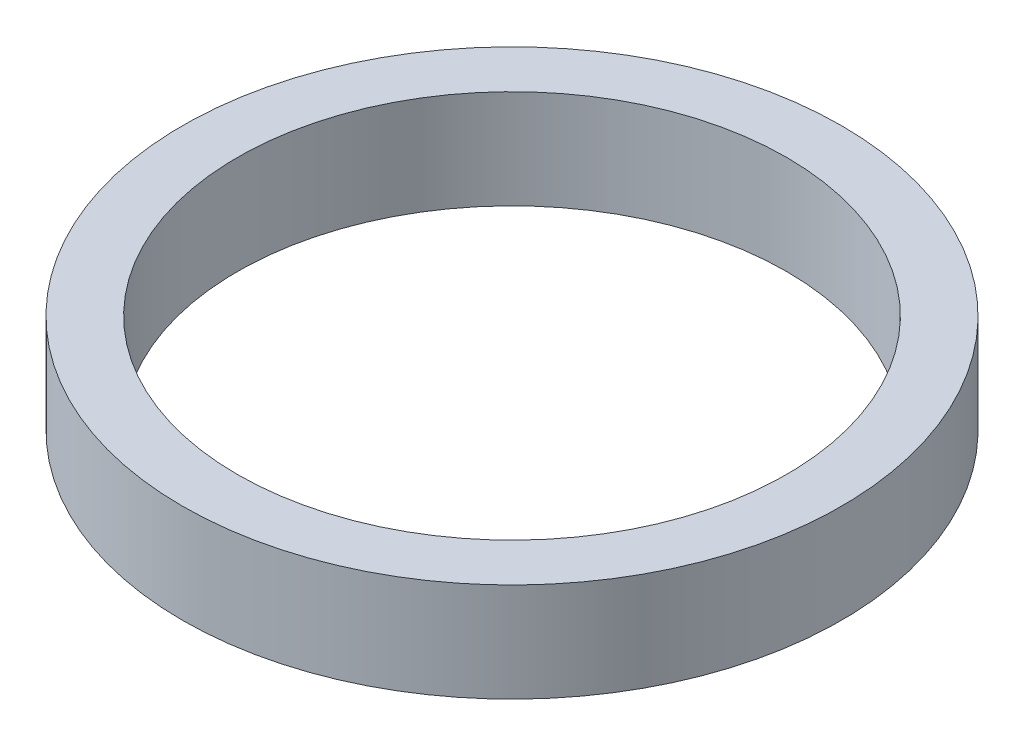
from build123d import *

# Parameters (mm, degrees)
SKETCH1_R           = 60
BOSS_EXTRUDE1_DEPTH = 18
SKETCH2_R           = 50
CUT_EXTRUDE1_DEPTH  = 87.740993769


with BuildPart() as part:
    # Sketch1 → Boss-Extrude1 (new body)
    with BuildSketch(Plane(origin=(0, 0, 0), x_dir=(1, 0, 0), z_dir=(0, 1, 0))):
        Circle(SKETCH1_R)
    extrude(amount=BOSS_EXTRUDE1_DEPTH)

    # Sketch2 → Cut-Extrude1 (cut, through all)
    with BuildSketch(Plane(origin=(0, 0, 0), x_dir=(1, 0, 0), z_dir=(0, 1, 0))):
        Circle(SKETCH2_R)
    extrude(amount=CUT_EXTRUDE1_DEPTH, mode=Mode.SUBTRACT)


solid = part.part
